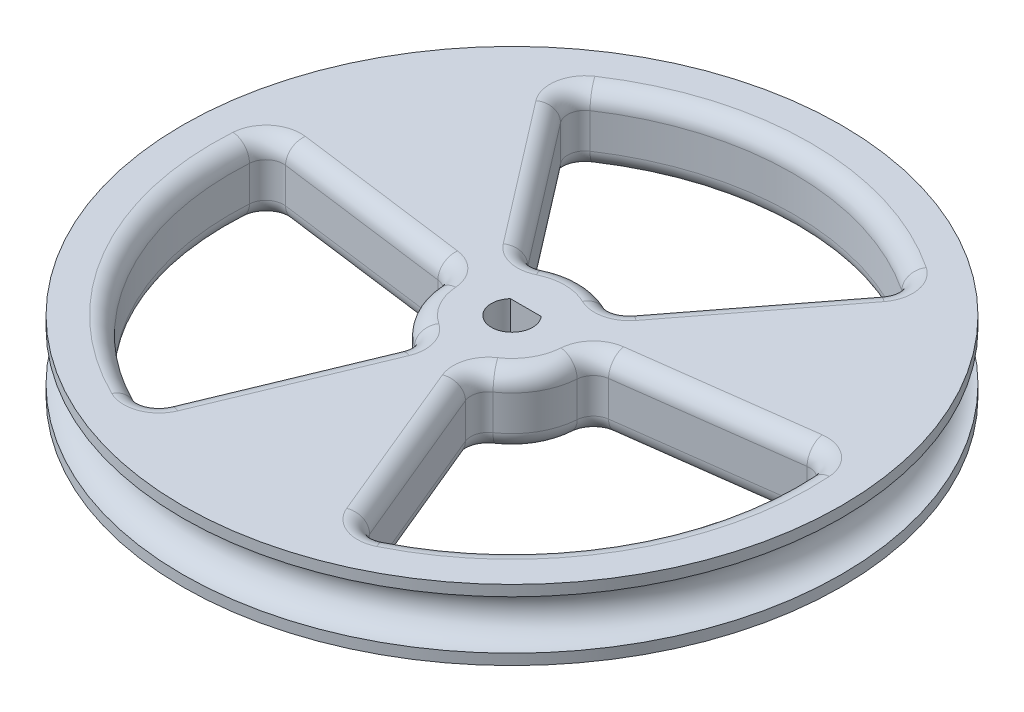
from build123d import *

# Parameters (mm, degrees)
SKETCH1_R                 = 23.815610662
BOSS_EXTRUDE1_DEPTH       = 5.08
CUT_EXTRUDE1_DEPTH        = 5.08
CUT_EXTRUDE3_DEPTH        = 35.061312694
FILLET22_R                = 1.27
CIRPATTERN1_COUNT         = 3
FILLET22_OF_CIRPATTERN1_R = 1.27


with BuildPart() as part:
    # Sketch1 → Boss-Extrude1 (new body)
    with BuildSketch(Plane(origin=(0, 0, 0), x_dir=(1, 0, 0), z_dir=(0, 1, 0))):
        Circle(SKETCH1_R)
    extrude(amount=BOSS_EXTRUDE1_DEPTH)

    # Sketch2 → Cut-Extrude1 (cut)
    with BuildSketch(Plane(origin=(0, 5.08, 0), x_dir=(1, 0, 0), z_dir=(0, 1, 0))):
        with BuildLine():
            Line((-1.114562695, 0.99225), (1.114562695, 0.99225))
            ThreePointArc((1.114562695, 0.99225), (0, -1.49225), (-1.114562695, 0.99225))
        make_face()
    extrude(amount=-CUT_EXTRUDE1_DEPTH, mode=Mode.SUBTRACT)

    # Sketch5 → Cut-Revolve2 (revolve, cut)
    with BuildSketch(Plane.XY):
        with BuildLine():
            Line((-23.815610662, 4.3053), (-23.815610662, 0.7747))
            ThreePointArc((-23.815610662, 0.7747), (-22.050310662, 2.54), (-23.815610662, 4.3053))
        make_face()
    revolve(axis=Axis((0, 4.3287014, 0), (0, -1, 0)), mode=Mode.SUBTRACT)

    # Sketch8 → Cut-Extrude3 (cut, through all)
    with BuildSketch(Plane(origin=(0, 5.08, 0), x_dir=(1, 0, 0), z_dir=(0, 1, 0))):
        with BuildLine():
            Line((-12.370032237, 16.120939875), (-3.092508059, 4.030234969))
            ThreePointArc((-3.092508059, 4.030234969), (0, 5.08), (3.092508059, 4.030234969))
            Line((3.092508059, 4.030234969), (12.370032237, 16.120939875))
            ThreePointArc((12.370032237, 16.120939875), (0, 20.32), (-12.370032237, 16.120939875))
        make_face()
    cut_extrude3 = extrude(amount=-CUT_EXTRUDE3_DEPTH, mode=Mode.SUBTRACT)

    # Fillet22
    fillet22_edges = [part.edges().sort_by_distance(p)[0] for p in [
        (7.731270148, 0, -10.075587422),
        (7.731270148, 5.08, -10.075587422),
        (-7.731270148, 0, -10.075587422),
        (-7.731270148, 5.08, -10.075587422),
        (-3.092508059, 2.54, -4.030234969),
        (0, 0, -5.08),
        (3.092508059, 2.54, -4.030234969),
        (0, 5.08, -5.08),
        (12.370032237, 2.54, -16.120939875),
        (0, 0, -20.32),
        (-12.370032237, 2.54, -16.120939875),
        (0, 5.08, -20.32),
    ]]
    fillet(fillet22_edges, radius=FILLET22_R)

    # CirPattern1: Cut-Extrude3 ×3 about axis
    cirpattern1_axis = Axis((0, 5.08, 0), (0, 1, 0))
    for i in range(1, CIRPATTERN1_COUNT):
        add(cut_extrude3.rotate(cirpattern1_axis, i * 360 / CIRPATTERN1_COUNT), mode=Mode.SUBTRACT)

    # Fillet22 of CirPattern1
    fillet22_of_cirpattern1_edges = [part.edges().sort_by_distance(p)[0] for p in [
        (-12.591349739, 0, -1.657682641),
        (-12.591349739, 5.08, -1.657682641),
        (-4.860079591, 0, 11.733270063),
        (-4.860079591, 5.08, 11.733270063),
        (-1.944031836, 2.54, 4.693308025),
        (-4.399409051, 0, 2.54),
        (-5.036539896, 2.54, -0.663073056),
        (-4.399409051, 5.08, 2.54),
        (-20.146159583, 2.54, -2.652292226),
        (-17.597636205, 0, 10.16),
        (-7.776127346, 2.54, 18.773232101),
        (-17.597636205, 5.08, 10.16),
        (4.860079591, 0, 11.733270063),
        (4.860079591, 5.08, 11.733270063),
        (12.591349739, 0, -1.657682641),
        (12.591349739, 5.08, -1.657682641),
        (5.036539896, 2.54, -0.663073056),
        (4.399409051, 0, 2.54),
        (1.944031836, 2.54, 4.693308025),
        (4.399409051, 5.08, 2.54),
        (7.776127346, 2.54, 18.773232101),
        (17.597636205, 0, 10.16),
        (20.146159583, 2.54, -2.652292226),
        (17.597636205, 5.08, 10.16),
    ]]
    fillet(fillet22_of_cirpattern1_edges, radius=FILLET22_OF_CIRPATTERN1_R)


solid = part.part
